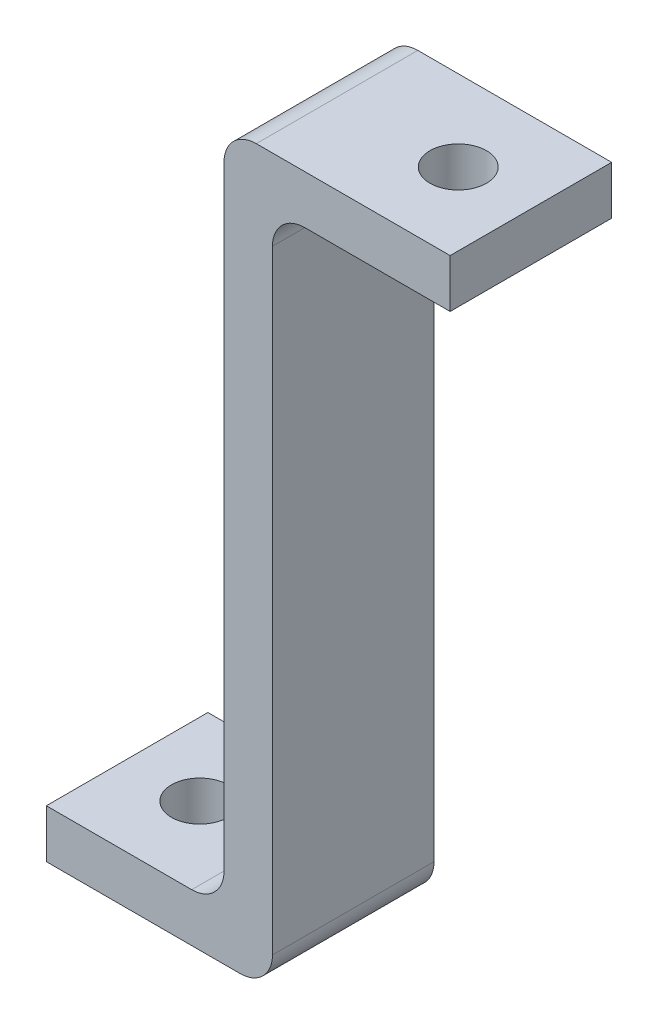
from build123d import *

# Parameters (mm, degrees)
BOSS_EXTRUDE1_DEPTH   = 10
FILLET1_R             = 2
F_3_0MM_DOWEL_HOLE1_D = 3.5
F_3_0MM_DOWEL_HOLE2_D = 3.5


with BuildPart() as part:
    # Sketch1 → Boss-Extrude1 (new body)
    with BuildSketch(Plane.XY):
        Polygon((0, 0), (14, 0), (14, 42), (25, 42), (25, 45), (11, 45), (11, 3), (0, 3), align=None)
    extrude(amount=-BOSS_EXTRUDE1_DEPTH)

    # Fillet1
    fillet1_edges = [part.edges().sort_by_distance(p)[0] for p in [
        (14, 0, -5),
        (11, 45, -5),
        (11, 3, -5),
        (14, 42, -5),
    ]]
    fillet(fillet1_edges, radius=FILLET1_R)

    # Ø3.0mm Dowel Hole1 (through all)
    with Locations(Plane(origin=(4.5, 0, -5), x_dir=(0, 0, -1), z_dir=(0, -1, 0))):
        with Locations((0, 0)):
            Hole(F_3_0MM_DOWEL_HOLE1_D / 2)

    # Ø3.0mm Dowel Hole2 (through all)
    with Locations(Plane(origin=(0, 45, 0), x_dir=(1, 0, 0), z_dir=(0, 1, 0))):
        with Locations((20.5, 5)):
            Hole(F_3_0MM_DOWEL_HOLE2_D / 2)


solid = part.part
